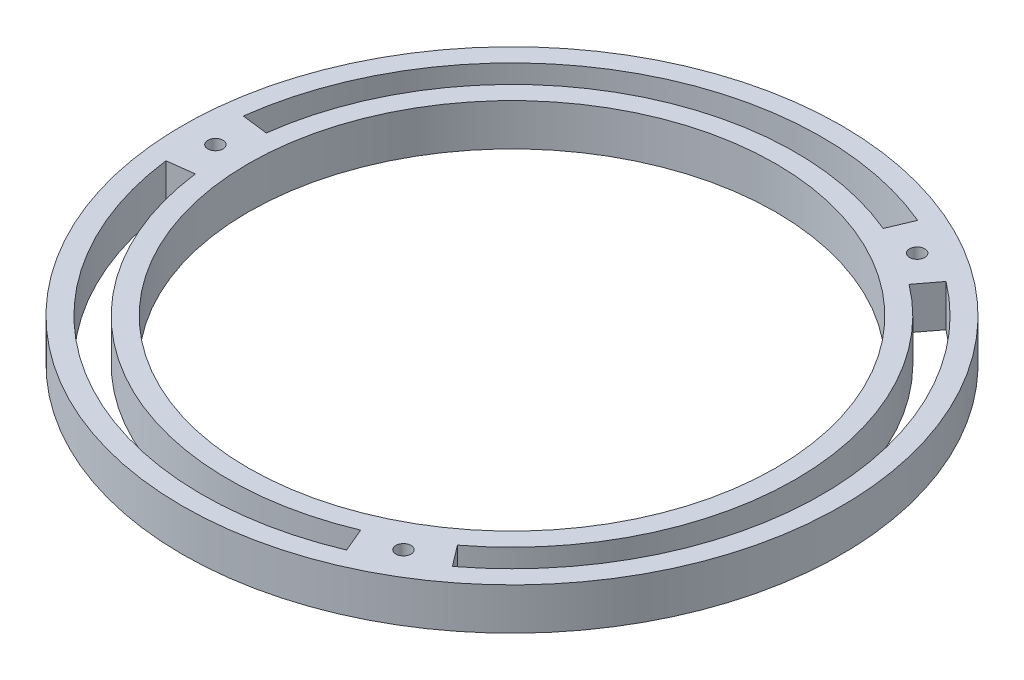
from build123d import *

# Parameters (mm, degrees)
SKETCH1_R           = 50
SKETCH1_R_2         = 40
BOSS_EXTRUDE1_DEPTH = 6.35
M2_HOLES_REACH      = 72.995
SKETCH2_R           = 1.15


with BuildPart() as part:
    # Sketch1 → Boss-Extrude1 (new body)
    with BuildSketch(Plane(origin=(0, 0, 0), x_dir=(1, 0, 0), z_dir=(0, 1, 0))):
        Circle(SKETCH1_R)
        with BuildLine():
            Line((28.403582676, -37.446448312), (25.986256491, -34.259516541))
            ThreePointArc((25.986256491, -34.259516541), (43, 0), (25.986256491, 34.259516541))
            Line((25.986256491, 34.259516541), (28.403582676, 37.446448312))
            ThreePointArc((28.403582676, 37.446448312), (47, 0), (28.403582676, -37.446448312))
        make_face(mode=Mode.SUBTRACT)
        with BuildLine():
            ThreePointArc((18.227784182, -43.321448312), (-23.5, -40.703193978), (-46.631366858, -5.875))
            Line((-46.631366858, -5.875), (-42.662739891, -5.375))
            ThreePointArc((-42.662739891, -5.375), (-21.5, -37.239092363), (16.6764834, -39.634516541))
            Line((16.6764834, -39.634516541), (18.227784182, -43.321448312))
        make_face(mode=Mode.SUBTRACT)
        with BuildLine():
            Line((18.227784182, 43.321448312), (16.6764834, 39.634516541))
            ThreePointArc((16.6764834, 39.634516541), (-21.5, 37.239092363), (-42.662739891, 5.375))
            Line((-42.662739891, 5.375), (-46.631366858, 5.875))
            ThreePointArc((-46.631366858, 5.875), (-23.5, 40.703193978), (18.227784182, 43.321448312))
        make_face(mode=Mode.SUBTRACT)
        Circle(SKETCH1_R_2, mode=Mode.SUBTRACT)
    extrude(amount=BOSS_EXTRUDE1_DEPTH)

    # Sketch2 → M2 holes (cut, up to next)
    with BuildSketch(Plane(origin=(0, 6.35, 0), x_dir=(1, 0, 0), z_dir=(0, 1, 0)), mode=Mode.PRIVATE) as m2_holes_sk1:
        with Locations((-45, 0)):
            Circle(SKETCH2_R)
    m2_holes_tool1 = extrude(m2_holes_sk1.sketch, amount=-M2_HOLES_REACH, mode=Mode.PRIVATE) & part.part
    # Sketch2 → M2 holes (cut, up to next)
    with BuildSketch(Plane(origin=(0, 6.35, 0), x_dir=(1, 0, 0), z_dir=(0, 1, 0)), mode=Mode.PRIVATE) as m2_holes_sk2:
        with Locations((22.5, -38.97114317)):
            Circle(SKETCH2_R)
    m2_holes_tool2 = extrude(m2_holes_sk2.sketch, amount=-M2_HOLES_REACH, mode=Mode.PRIVATE) & part.part
    # Sketch2 → M2 holes (cut, up to next)
    with BuildSketch(Plane(origin=(0, 6.35, 0), x_dir=(1, 0, 0), z_dir=(0, 1, 0)), mode=Mode.PRIVATE) as m2_holes_sk3:
        with Locations((22.5, 38.97114317)):
            Circle(SKETCH2_R)
    m2_holes_tool3 = extrude(m2_holes_sk3.sketch, amount=-M2_HOLES_REACH, mode=Mode.PRIVATE) & part.part
    add(m2_holes_tool1.solids().sort_by_distance((-45, 6.35, 0))[0], mode=Mode.SUBTRACT)
    add(m2_holes_tool2.solids().sort_by_distance((22.5, 6.35, 38.971143))[0], mode=Mode.SUBTRACT)
    add(m2_holes_tool3.solids().sort_by_distance((22.5, 6.35, -38.971143))[0], mode=Mode.SUBTRACT)


solid = part.part
